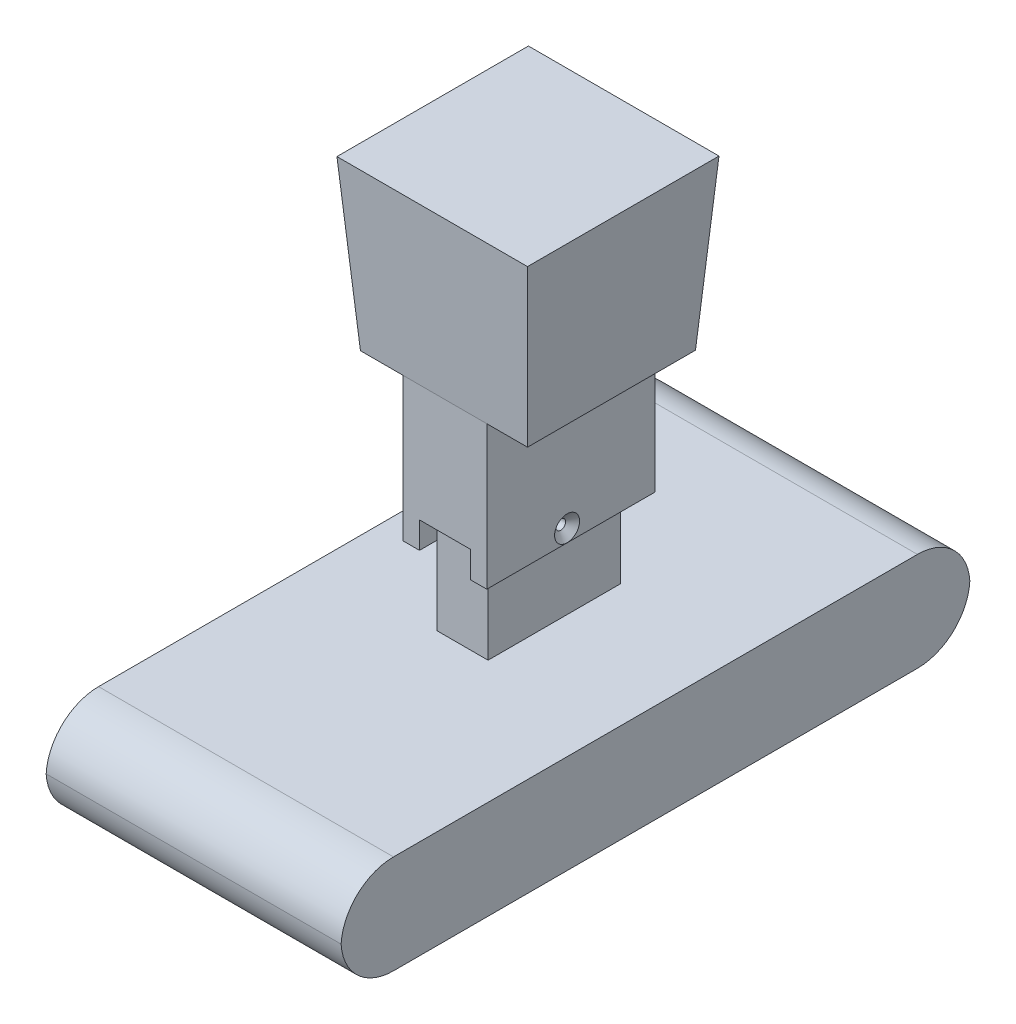
from build123d import *

# Parameters (mm, degrees)
SKETCH5_W                       = 20.209666631
SKETCH5_H                       = 20.346218433
BOSS_EXTRUDE3_DEPTH             = 20.32
DRAFT4_ANGLE                    = 4
DRAFT5_ANGLE                    = 4
SKETCH6_W                       = 10.134168445
SKETCH6_H                       = 17.341048708
BOSS_EXTRUDE4_DEPTH             = 20.32
SKETCH7_W                       = 6.151087315
SKETCH7_H                       = 12.30217463
BOSS_EXTRUDE5_DEPTH             = 20.32
CUT_EXTRUDE1_DEPTH              = 20.32
SKETCH9_W                       = 6.151087315
SKETCH9_H                       = 16.039002112
BOSS_EXTRUDE8_DEPTH             = 12.7
F_0_80_TAPPED_HOLE1_D           = 1.19126
F_0_80_TAPPED_HOLE1_DEPTH       = 4.0005
F_0_80_TAPPED_HOLE1_CSINK_D     = 3.0226
F_0_80_TAPPED_HOLE1_CSINK_ANGLE = 100
F_0_80_TAPPED_HOLE1_TIP         = 0.357890611
F_0_80_TAPPED_HOLE3_D           = 1.19126
F_0_80_TAPPED_HOLE3_DEPTH       = 4.064
F_0_80_TAPPED_HOLE3_CSINK_D     = 3.0226
F_0_80_TAPPED_HOLE3_CSINK_ANGLE = 100
F_0_80_TAPPED_HOLE3_TIP         = 0.357890611
SKETCH28_W                      = 35.682781241
SKETCH28_H                      = 76.087494434
BOSS_EXTRUDE13_DEPTH            = 11.938
FILLET5_R                       = 6.35
FILLET6_R                       = 6.35


with BuildPart() as part:
    # Sketch5 → Boss-Extrude3 (new body)
    with BuildSketch(Plane.XY):
        with Locations((-110.129027961, 66.022796056)):
            Rectangle(SKETCH5_W, SKETCH5_H)
    extrude(amount=BOSS_EXTRUDE3_DEPTH)

    # Draft4
    draft4_faces = [part.faces().sort_by_distance(p)[0] for p in [
        (-100.024194645, 66.022796056, 10.16),
        (-120.233861276, 66.022796056, 10.16),
        (-110.129027961, 66.022796056, 20.32),
    ]]
    draft(draft4_faces, Plane(origin=(-120.233861276, 55.849686839, 20.32), x_dir=(0, 0, -1), z_dir=(0, -1, 0)), DRAFT4_ANGLE)

    # Draft5
    draft5_faces = [part.faces().sort_by_distance(p)[0] for p in [
        (-110.129027961, 66.245821761, 0),
    ]]
    draft(draft5_faces, Plane(origin=(-120.233861276, 55.849686839, 20.32), x_dir=(0, 0, -1), z_dir=(0, -1, 0)), DRAFT5_ANGLE)

    # Sketch6 → Boss-Extrude4 (add)
    with BuildSketch(Plane.XY):
        with Locations((-110.017330359, 47.179162485)):
            Rectangle(SKETCH6_W, SKETCH6_H)
    extrude(amount=BOSS_EXTRUDE4_DEPTH)

    # Sketch7 → Boss-Extrude5 (add)
    with BuildSketch(Plane.XY):
        with Locations((-110.013841195, 32.357550816)):
            Rectangle(SKETCH7_W, SKETCH7_H)
    extrude(amount=BOSS_EXTRUDE5_DEPTH)

    # Sketch8 → Cut-Extrude1 (cut)
    with BuildSketch(Plane(origin=(0, 0, 0), x_dir=(-1, 0, 0), z_dir=(0, 0, -1))):
        Polygon((113.089384852, 38.508638131), (113.089384852, 41.703281679), (106.938297537, 41.703281679), (106.938297537, 38.508638131), (106.938297537, 26.206463501), (113.089384852, 26.206463501), align=None)
    extrude(amount=-CUT_EXTRUDE1_DEPTH, mode=Mode.SUBTRACT)

    # Sketch9 → Boss-Extrude8 (add)
    with BuildSketch(Plane.XZ.offset(-41.703281679)):
        with Locations((-110.013841195, 10.15769714)):
            Rectangle(SKETCH9_W, SKETCH9_H)
    extrude(amount=BOSS_EXTRUDE8_DEPTH)

    # #0-80 Tapped Hole1
    with Locations(Plane(origin=(-104.950246136, 0, 0), x_dir=(0, 0, -1), z_dir=(1, 0, 0))):
        with Locations((-10.606199537, 40.03468966)):
            CounterSinkHole(F_0_80_TAPPED_HOLE1_D / 2, F_0_80_TAPPED_HOLE1_CSINK_D / 2, depth=F_0_80_TAPPED_HOLE1_DEPTH, counter_sink_angle=F_0_80_TAPPED_HOLE1_CSINK_ANGLE)
            with Locations((0, 0, -(F_0_80_TAPPED_HOLE1_DEPTH + F_0_80_TAPPED_HOLE1_TIP / 2))):  # 118° drill point
                Cone(0, F_0_80_TAPPED_HOLE1_D / 2, F_0_80_TAPPED_HOLE1_TIP, mode=Mode.SUBTRACT)

    # #0-80 Tapped Hole3
    with Locations(Plane.ZY.offset(115.084414581)):
        with Locations((10.610590501, 40.003135548)):
            CounterSinkHole(F_0_80_TAPPED_HOLE3_D / 2, F_0_80_TAPPED_HOLE3_CSINK_D / 2, depth=F_0_80_TAPPED_HOLE3_DEPTH, counter_sink_angle=F_0_80_TAPPED_HOLE3_CSINK_ANGLE)
            with Locations((0, 0, -(F_0_80_TAPPED_HOLE3_DEPTH + F_0_80_TAPPED_HOLE3_TIP / 2))):  # 118° drill point
                Cone(0, F_0_80_TAPPED_HOLE3_D / 2, F_0_80_TAPPED_HOLE3_TIP, mode=Mode.SUBTRACT)

    # Sketch28 → Boss-Extrude13 (add)
    with BuildSketch(Plane(origin=(0, 29.003281679, 0), x_dir=(-1, 0, 0), z_dir=(0, -1, 0))):
        with Locations((109.89388319, -12.810019293)):
            Rectangle(SKETCH28_W, SKETCH28_H)
    extrude(amount=BOSS_EXTRUDE13_DEPTH)

    # Fillet5
    # the kernel refuses this fillet: 6.35 mm, written as the material it takes off along each edge
    with BuildSketch(Plane(origin=(-76.177492569, 17.065281679, -25.233727924), x_dir=(0, 1, 0), z_dir=(-1, 0, 0))) as fillet5_piece_1:
        with BuildLine():
            CenterArc((FILLET5_R, -FILLET5_R), FILLET5_R, 90, 90)
            Line((0, -FILLET5_R), (0, 0))
            Line((0, 0), (FILLET5_R, 0))
        make_face()
    extrude(amount=67.43278124, mode=Mode.SUBTRACT)
    with BuildSketch(Plane(origin=(-76.177492569, 29.003281679, -25.233727924), x_dir=(0, -1, 0), z_dir=(-1, 0, 0))) as fillet5_piece_2:
        with BuildLine():
            CenterArc((FILLET5_R, FILLET5_R), FILLET5_R, 180, 90)
            Line((0, FILLET5_R), (0, 0))
            Line((0, 0), (FILLET5_R, 0))
        make_face()
    extrude(amount=67.43278124, mode=Mode.SUBTRACT)

    # Fillet6
    # the kernel refuses this fillet: 6.35 mm, written as the material it takes off along each edge
    with BuildSketch(Plane(origin=(-143.61027381, 17.065281679, 50.85376651), x_dir=(0, 1, 0), z_dir=(1, 0, 0)), Plane(origin=(-143.61027381, 29.003281679, 50.85376651), x_dir=(0, 0, -1), z_dir=(1, 0, 0))) as fillet6_piece_1:
        with BuildLine():
            CenterArc((FILLET6_R, -FILLET6_R), FILLET6_R, 90, 90)
            Line((0, -FILLET6_R), (0, 0))
            Line((0, 0), (FILLET6_R, 0))
        make_face()
    extrude(amount=67.43278124, mode=Mode.SUBTRACT)


solid = part.part
